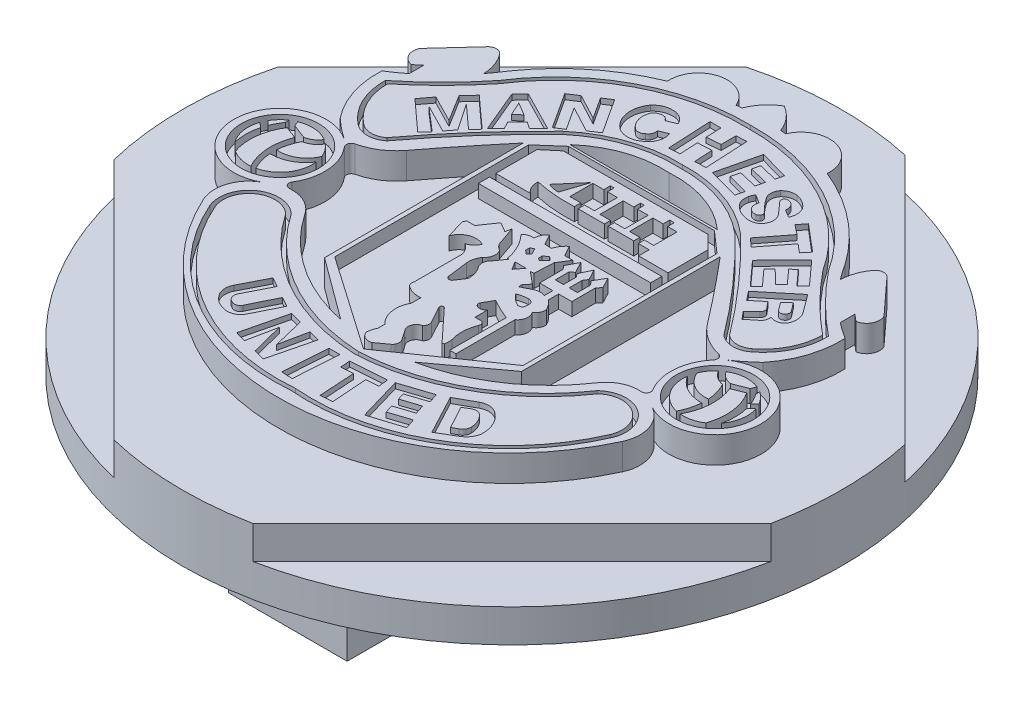
from build123d import *

# Parameters (mm, degrees)
IZIM1_W                     = 300
IZIM1_H                     = 300
Y_KSEKLIK_EKSTR_ZYON1_DEPTH = 35
KES_EKSTR_ZYON1_DEPTH       = 10
KES_EKSTR_ZYON2_DEPTH       = 10
IZIM4_R                     = 14.688787929
KES_EKSTR_ZYON3_DEPTH       = 5
KES_EKSTR_ZYON4_DEPTH       = 5
IZIM6_W                     = 65.340967954
IZIM6_H                     = 4.211050824
KES_EKSTR_ZYON5_DEPTH       = 5
KES_EKSTR_ZYON6_DEPTH       = 2
KES_EKSTR_ZYON7_DEPTH       = 2
KES_EKSTR_ZYON8_DEPTH       = 214.600093633
KES_EKSTR_ZYON8_DEPTH_BACK  = 214.600093633
IZIM9_W                     = 367.063138071
IZIM9_H                     = 317.584407861
IZIM9_R                     = 125
IZIM10_W                    = 593.86793566
IZIM10_H                    = 460.810210373
KES_EKSTR_ZYON9_DEPTH       = 12.5
SCALE1_SCALE_X              = 0.1
SCALE1_SCALE_Y              = 0.1
SCALE1_SCALE_Z              = 0.1
SKETCH1_W                   = 4.5
SKETCH1_H                   = 3
BOSS_EXTRUDE1_DEPTH         = 4


with BuildPart() as part:
    # Çizim1 → Yükseklik-Ekstrüzyon1 (new body)
    with BuildSketch(Plane(origin=(0, 0, 0), x_dir=(1, 0, 0), z_dir=(0, 1, 0))):
        Rectangle(IZIM1_W, IZIM1_H)
    extrude(amount=Y_KSEKLIK_EKSTR_ZYON1_DEPTH)

    # Çizim2 → Kes-Ekstrüzyon1 (cut)
    with BuildSketch(Plane(origin=(0, 35, 0), x_dir=(1, 0, 0), z_dir=(0, 1, 0))):
        with BuildLine():
            Line((0, 150), (0, 104.219558276))
            ThreePointArc((0, 104.219558276), (4.432980086, 100.525251747), (7.359868412, 95.552069879))
            ThreePointArc((7.359868412, 95.552069879), (8.383740752, 95.473303208), (9.406438792, 95.380526726))
            ThreePointArc((9.406438792, 95.380526726), (22.041401655, 101.728253005), (30.290376925, 90.243901807))
            ThreePointArc((30.290376925, 90.243901807), (48.895981366, 79.362277258), (63.63888613, 63.63888613))
            ThreePointArc((63.63888613, 63.63888613), (65.590542943, 60.704656554), (67.673431335, 57.862079648))
            ThreePointArc((67.673431335, 57.862079648), (68.570213066, 62.822644067), (70.963013461, 67.259526204))
            ThreePointArc((70.963013461, 67.259526204), (73.293815615, 68.477288098), (75.723786132, 67.471889672))
            Line((75.723786132, 67.471889672), (87.997898915, 54.072975184))
            ThreePointArc((87.997898915, 54.072975184), (87.89207184, 49.687125695), (84.346755161, 47.103019512))
            Line((84.346755161, 47.103019512), (81.764137181, 49.283896918))
            Line((81.764137181, 49.283896918), (81.764137181, 43.732968519))
            ThreePointArc((81.764137181, 43.732968519), (84.761025634, 41.530263518), (87.860036516, 39.473717561))
            ThreePointArc((87.860036516, 39.473717561), (86.178046704, 27.021815231), (80.159790477, 15.991876275))
            ThreePointArc((80.159790477, 15.991876275), (76.46978014, 12.812148568), (72.561917191, 9.904322618))
            ThreePointArc((72.561917191, 9.904322618), (99.979717827, -3.657702738), (73.992952405, -19.793140332))
            ThreePointArc((73.992952405, -19.793140332), (80.030307363, -27.115490075), (79.482218011, -36.589985244))
            ThreePointArc((79.482218011, -36.589985244), (47.194418585, -73.681319576), (0, -87.5))
            Line((0, -87.5), (0, -150))
            Line((0, -150), (150, -150))
            Line((150, -150), (150, 150))
            Line((150, 150), (0, 150))
        make_face()
    kes_ekstr_zyon1 = extrude(amount=-KES_EKSTR_ZYON1_DEPTH, mode=Mode.SUBTRACT)

    # Çizim3 → Kes-Ekstrüzyon2 (cut)
    with BuildSketch(Plane(origin=(0, 35, 0), x_dir=(1, 0, 0), z_dir=(0, 1, 0))):
        with BuildLine():
            Line((0, 60.484534465), (0, 50.936189454))
            Line((0, 50.936189454), (27.929597264, 50.936189454))
            ThreePointArc((27.929597264, 50.936189454), (14.932854005, 58.541993689), (0, 60.484534465))
        make_face()
        with BuildLine():
            Line((37.348789557, 42.612665797), (37.348789557, -32.761995334))
            Line((37.348789557, -32.761995334), (13.949565394, -50.019716103))
            ThreePointArc((13.949565394, -50.019716103), (37.262544693, -40.226677559), (55.228500691, -22.432773185))
            ThreePointArc((55.228500691, -22.432773185), (60.177397232, -17.950437876), (66.732679932, -16.681116981))
            ThreePointArc((66.732679932, -16.681116981), (68.359310734, -15.854962574), (68.35712211, -14.030557443))
            ThreePointArc((68.35712211, -14.030557443), (65.68599224, -3.061198459), (69.963231631, 7.387102575))
            ThreePointArc((69.963231631, 7.387102575), (70.306076089, 9.173128049), (68.957221273, 10.392972301))
            ThreePointArc((68.957221273, 10.392972301), (62.330623094, 13.16964935), (57.050039772, 18.041730899))
            ThreePointArc((57.050039772, 18.041730899), (47.34946827, 30.447513007), (37.348789557, 42.612665797))
        make_face()
    kes_ekstr_zyon2 = extrude(amount=-KES_EKSTR_ZYON2_DEPTH, mode=Mode.SUBTRACT)

    # Çizim4 → Kes-Ekstrüzyon3 (cut)
    with BuildSketch(Plane(origin=(0, 35, 0), x_dir=(1, 0, 0), z_dir=(0, 1, 0))):
        with Locations((82.5, -4.5)):
            Circle(IZIM4_R)
        with BuildLine():
            Line((82.5, 1.078851419), (87.159313296, 2.881859687))
            ThreePointArc((87.159313296, 2.881859687), (90.232750957, -5.668478078), (89.233474204, -14.699299797))
            ThreePointArc((89.233474204, -14.699299797), (85.486297127, -16.351051458), (81.403841132, -16.672256444))
            ThreePointArc((81.403841132, -16.672256444), (83.96523767, -7.921028015), (82.5, 1.078851419))
        make_face(mode=Mode.SUBTRACT)
        with BuildLine():
            Line((80.967380155, 2.881859687), (86.35286518, 4.965873662))
            Line((86.35286518, 4.965873662), (87.107444607, 6.819754653))
            ThreePointArc((87.107444607, 6.819754653), (81.576062803, 7.686538937), (76.238588844, 5.9957192))
            ThreePointArc((76.238588844, 5.9957192), (78.229966806, 3.872314681), (80.967380155, 2.881859687))
        make_face(mode=Mode.SUBTRACT)
        with BuildLine():
            Line((89.233474204, 4.221967119), (89.233474204, 5.699299797))
            ThreePointArc((89.233474204, 5.699299797), (91.406865656, 3.868580249), (93.098723839, 1.585428841))
            Line((93.098723839, 1.585428841), (91.509736411, 0))
            ThreePointArc((91.509736411, 0), (90.500671693, 2.180569354), (89.233474204, 4.221967119))
        make_face(mode=Mode.SUBTRACT)
        with BuildLine():
            Line((92.201834683, -2.118971392), (94.082148833, -0.598818179))
            ThreePointArc((94.082148833, -0.598818179), (94.570520121, -6.415185421), (92.305735984, -11.79471953))
            ThreePointArc((92.305735984, -11.79471953), (92.857538804, -6.950362161), (92.201834683, -2.118971392))
        make_face(mode=Mode.SUBTRACT)
        with BuildLine():
            ThreePointArc((70.382445993, -2.909315847), (72.461507033, -11.470943275), (79.757489881, -16.409829111))
            ThreePointArc((79.757489881, -16.409829111), (81.213206681, -12.777519679), (81.882268825, -8.921986117))
            ThreePointArc((81.882268825, -8.921986117), (75.339135912, -7.432765055), (70.382445993, -2.909315847))
        make_face(mode=Mode.SUBTRACT)
        with BuildLine():
            ThreePointArc((79.757489881, 1.078851419), (81.213206681, -2.553458012), (81.882268825, -6.408991575))
            ThreePointArc((81.882268825, -6.408991575), (75.445718089, -4.988320525), (71.13710463, 0))
            ThreePointArc((71.13710463, 0), (72.551809573, 2.599218155), (74.549779065, 4.782207619))
            ThreePointArc((74.549779065, 4.782207619), (76.727879252, 2.331826625), (79.757489881, 1.078851419))
        make_face(mode=Mode.SUBTRACT)
    kes_ekstr_zyon3 = extrude(amount=-KES_EKSTR_ZYON3_DEPTH, mode=Mode.SUBTRACT)

    # Çizim5 → Kes-Ekstrüzyon4 (cut)
    with BuildSketch(Plane(origin=(0, 35, 0), x_dir=(1, 0, 0), z_dir=(0, 1, 0))):
        with BuildLine():
            Line((0, 91.537897666), (0, 90.037373971))
            ThreePointArc((0, 90.037373971), (34.910747951, 81.866816476), (61.312588474, 57.608598297))
            ThreePointArc((61.312588474, 57.608598297), (71.365293645, 46.386208855), (82.532386084, 36.272112135))
            ThreePointArc((82.532386084, 36.272112135), (80.156394342, 26.33060929), (73.659387451, 18.43961968))
            ThreePointArc((73.659387451, 18.43961968), (69.304921982, 16.976537244), (64.970096435, 18.496822487))
            ThreePointArc((64.970096435, 18.496822487), (50.048409379, 36.848130455), (33.7148102, 53.95487727))
            ThreePointArc((33.7148102, 53.95487727), (17.964521879, 62.989894684), (0, 65.631688683))
            Line((0, 65.631688683), (0, 64.13036191))
            ThreePointArc((0, 64.13036191), (17.422952638, 61.590013273), (32.704829119, 52.84490601))
            ThreePointArc((32.704829119, 52.84490601), (48.999811849, 35.769263278), (63.881125884, 17.448495569))
            ThreePointArc((63.881125884, 17.448495569), (69.192296648, 15.477862031), (74.572975106, 17.249931654))
            ThreePointArc((74.572975106, 17.249931654), (81.659613563, 25.990705626), (84.026783329, 36.991527484))
            ThreePointArc((84.026783329, 36.991527484), (72.705602185, 47.166452817), (62.530676853, 58.48763396))
            ThreePointArc((62.530676853, 58.48763396), (35.593910706, 83.202369286), (0, 91.537897666))
        make_face()
        with BuildLine():
            Line((0, -57.172237214), (0, -58.673870888))
            ThreePointArc((0, -58.673870888), (33.470224231, -49.143475695), (59.173411607, -25.682220373))
            ThreePointArc((59.173411607, -25.682220373), (71.412315214, -24.833022665), (74.953049001, -36.579303033))
            ThreePointArc((74.953049001, -36.579303033), (44.650227003, -70.940446986), (0, -81.202340739))
            Line((0, -81.202340739), (0, -82.707691122))
            ThreePointArc((0, -82.707691122), (45.482168484, -72.190814928), (76.33669671, -37.158966235))
            ThreePointArc((76.33669671, -37.158966235), (72.200787985, -23.554931007), (58.028078533, -24.699405655))
            ThreePointArc((58.028078533, -24.699405655), (32.84198284, -47.776253871), (0, -57.172237214))
        make_face()
    kes_ekstr_zyon4 = extrude(amount=-KES_EKSTR_ZYON4_DEPTH, mode=Mode.SUBTRACT)

    # Aynalama1: Kes-Ekstrüzyon1, Kes-Ekstrüzyon2, Kes-Ekstrüzyon3, Kes-Ekstrüzyon4 across plane
    add(kes_ekstr_zyon1.mirror(Plane(origin=(0, 0, 0), x_dir=(0, 0, 1), z_dir=(1, 0, 0))), mode=Mode.SUBTRACT)
    add(kes_ekstr_zyon2.mirror(Plane(origin=(0, 0, 0), x_dir=(0, 0, 1), z_dir=(1, 0, 0))), mode=Mode.SUBTRACT)
    add(kes_ekstr_zyon3.mirror(Plane(origin=(0, 0, 0), x_dir=(0, 0, 1), z_dir=(1, 0, 0))), mode=Mode.SUBTRACT)
    add(kes_ekstr_zyon4.mirror(Plane(origin=(0, 0, 0), x_dir=(0, 0, 1), z_dir=(1, 0, 0))), mode=Mode.SUBTRACT)

    # Çizim6 → Kes-Ekstrüzyon5 (cut)
    # profile 1 of 2: a face of its own
    with BuildSketch(Plane(origin=(0, 35, 0), x_dir=(1, 0, 0), z_dir=(0, 1, 0))):
        Polygon((0, -55.345861268), (35.697267904, -30.549471324), (35.697267904, 43.034530322), (27.694930839, 50.073043118), (-27.694930839, 50.073043118), (-35.697267904, 43.034530322), (-35.697267904, -30.549471324), align=None)
        with BuildLine():
            ThreePointArc((-11.906869674, 1.566702336), (-17.201780851, 1.865280834), (-20.93529079, -1.901168027))
            Line((-20.93529079, -1.901168027), (-23.027971181, 5.154154435))
            Line((-23.027971181, 5.154154435), (-22.489853367, 6.290180933))
            Line((-22.489853367, 6.290180933), (-19.437246224, 6.290180933))
            Line((-19.437246224, 6.290180933), (-15.374740037, 12.149686028))
            Line((-15.374740037, 12.149686028), (-11.730178712, 10.012920652))
            Line((-11.730178712, 10.012920652), (-11.254544638, 12.149686028))
            Line((-11.254544638, 12.149686028), (-8.739608735, 4.872878505))
            ThreePointArc((-8.739608735, 4.872878505), (-7.78070785, 3.722161336), (-6.572730693, 2.83647962))
            ThreePointArc((-6.572730693, 2.83647962), (-5.944152943, -0.103025266), (-7.489272369, -2.681475368))
            ThreePointArc((-7.489272369, -2.681475368), (-8.539801594, -5.012163464), (-8.739608735, -7.560848568))
            Line((-8.739608735, -7.560848568), (-7.731825436, -15.169890206))
            ThreePointArc((-7.731825436, -15.169890206), (-6.850368543, -16.300796116), (-5.540421445, -15.717741203))
            Line((-5.540421445, -15.717741203), (-3.318581286, -12.430635216))
            ThreePointArc((-3.318581286, -12.430635216), (-3.666975032, -9.505418471), (-4.96213428, -6.859509604))
            ThreePointArc((-4.96213428, -6.859509604), (-5.713341099, -4.342443779), (-4.509677827, -2.007678956))
            Line((-4.509677827, -2.007678956), (-1.817665055, 1.817665055))
            Line((-1.817665055, 1.817665055), (-2.45075469, 1.817665055))
            ThreePointArc((-2.45075469, 1.817665055), (-4.3537065, 7.360681259), (-7.731825436, 12.149686028))
            ThreePointArc((-7.731825436, 12.149686028), (-6.062401085, 13.24467592), (-4.067810621, 13.331793129))
            ThreePointArc((-4.067810621, 13.331793129), (-3.611472225, 15.589645574), (-2.214160024, 17.420945933))
            Line((-2.214160024, 17.420945933), (0, 13.469173456))
            Line((0, 13.469173456), (2.592810866, 13.331793129))
            ThreePointArc((2.592810866, 13.331793129), (3.668655292, 15.580143772), (5.349122264, 17.420945933))
            Line((5.349122264, 17.420945933), (7.471263253, 13.469173456))
            Line((7.471263253, 13.469173456), (10.601117285, 13.469173456))
            Line((10.601117285, 13.469173456), (7.860312167, 9.196808432))
            Line((7.860312167, 9.196808432), (7.471263253, 1.817665055))
            Line((7.471263253, 1.817665055), (6.086593146, 1.817665055))
            Line((6.086593146, 1.817665055), (10.733699088, -2.007678956))
            Line((10.733699088, -2.007678956), (9.015399913, -4.095103848))
            ThreePointArc((9.015399913, -4.095103848), (8.866578815, -4.803846924), (9.15271193, -5.469123038))
            Line((9.15271193, -5.469123038), (12.568340548, -3.701674631))
            ThreePointArc((12.568340548, -3.701674631), (14.645767491, -3.151586354), (16.760653607, -3.533105072))
            Line((16.760653607, -3.533105072), (16.760653607, -0.278876303))
            Line((16.760653607, -0.278876303), (11.721279291, -0.278876303))
            Line((11.721279291, -0.278876303), (11.721279291, 8.662796732))
            Line((11.721279291, 8.662796732), (10.601117285, 10.012920652))
            Line((10.601117285, 10.012920652), (12.826771642, 14.273760924))
            Line((12.826771642, 14.273760924), (15.031582585, 10.012920652))
            Line((15.031582585, 10.012920652), (13.678220653, 8.890072153))
            Line((13.678220653, 8.890072153), (13.678220653, 3.722161336))
            Line((13.678220653, 3.722161336), (16.762614821, 3.722161336))
            Line((16.762614821, 3.722161336), (16.762614821, 8.661851969))
            Line((16.762614821, 8.661851969), (15.74739773, 9.885486471))
            Line((15.74739773, 9.885486471), (17.860877299, 14.272816161))
            Line((17.860877299, 14.272816161), (19.954360749, 10.227118447))
            Line((19.954360749, 10.227118447), (18.950211911, 8.661851969))
            Line((18.950211911, 8.661851969), (18.950211911, 3.722161336))
            Line((18.950211911, 3.722161336), (22.078611129, 3.722161336))
            Line((22.078611129, 3.722161336), (22.078611129, 8.661851969))
            Line((22.078611129, 8.661851969), (20.779951049, 10.227118447))
            Line((20.779951049, 10.227118447), (23.151898185, 14.272816161))
            Line((23.151898185, 14.272816161), (25.245381635, 10.227118447))
            Line((25.245381635, 10.227118447), (23.956906007, 8.661851969))
            Line((23.956906007, 8.661851969), (23.956906007, -0.278876303))
            Line((23.956906007, -0.278876303), (18.950211911, -0.278876303))
            Line((18.950211911, -0.278876303), (18.950211911, -4.095103848))
            ThreePointArc((18.950211911, -4.095103848), (20.574199594, -5.79542301), (21.797680338, -7.803286581))
            ThreePointArc((21.797680338, -7.803286581), (21.388710462, -9.821714741), (19.954360749, -11.29953391))
            ThreePointArc((19.954360749, -11.29953391), (20.748804959, -14.319714762), (19.133285806, -16.99230374))
            Line((19.133285806, -16.99230374), (19.133285806, -39.39680115))
            Line((19.133285806, -39.39680115), (16.78447584, -39.39680115))
            Line((16.78447584, -39.39680115), (16.78447584, -18.004713661))
            ThreePointArc((16.78447584, -18.004713661), (12.902995138, -16.302688983), (9.15271193, -14.328314066))
            Line((9.15271193, -14.328314066), (7.046465246, -18.004713661))
            ThreePointArc((7.046465246, -18.004713661), (6.935324535, -18.934225509), (7.500637825, -19.680392661))
            ThreePointArc((7.500637825, -19.680392661), (9.263552392, -19.961396521), (10.73358191, -18.948556872))
            Line((10.73358191, -18.948556872), (10.73358191, -23.767312936))
            Line((10.73358191, -23.767312936), (12.902995138, -23.767312936))
            ThreePointArc((12.902995138, -23.767312936), (14.0355512, -24.518153851), (14.071427648, -25.876519853))
            ThreePointArc((14.071427648, -25.876519853), (13.085493265, -30.599388515), (13.678220653, -35.387522728))
            ThreePointArc((13.678220653, -35.387522728), (13.811835683, -36.839167966), (13.678220653, -38.290813204))
            ThreePointArc((13.678220653, -38.290813204), (13.212730159, -38.460384409), (12.747239664, -38.290813204))
            Line((12.747239664, -38.290813204), (1.742324059, -26.42147861))
            ThreePointArc((1.742324059, -26.42147861), (0.800244742, -26.434849011), (0.626041283, -27.36077847))
            Line((0.626041283, -27.36077847), (3.913701048, -33.388041299))
            ThreePointArc((3.913701048, -33.388041299), (4.306791689, -35.024506546), (3.492837434, -36.497604381))
            ThreePointArc((3.492837434, -36.497604381), (1.175770799, -38.65050317), (2.002333093, -41.703463334))
            Line((2.002333093, -41.703463334), (4.350396814, -45.169680354))
            ThreePointArc((4.350396814, -45.169680354), (4.69631917, -46.994407706), (3.701230729, -48.562556673))
            Line((3.701230729, -48.562556673), (-0.532925097, -51.642946573))
            ThreePointArc((-0.532925097, -51.642946573), (-3.201120606, -51.416244529), (-4.96213428, -49.398946354))
            ThreePointArc((-4.96213428, -49.398946354), (-4.736247179, -47.550680958), (-4.067810621, -45.812779199))
            Line((-4.067810621, -45.812779199), (-4.067810621, -43.184786644))
            ThreePointArc((-4.067810621, -43.184786644), (-7.04698599, -37.516118586), (-5.944152943, -31.207945895))
            Line((-5.944152943, -31.207945895), (-5.944152943, -27.63272395))
            ThreePointArc((-5.944152943, -27.63272395), (-8.987982017, -27.430142399), (-11.727702965, -26.088552355))
            ThreePointArc((-11.727702965, -26.088552355), (-12.462599934, -25.016918877), (-12.412411918, -23.718476338))
            Line((-12.412411918, -23.718476338), (-12.412411918, -5.469123038))
            ThreePointArc((-12.412411918, -5.469123038), (-13.509756118, -3.192034431), (-15.374740037, -1.485830515))
            ThreePointArc((-15.374740037, -1.485830515), (-13.225031643, -0.431908753), (-11.906869674, 1.566702336))
        make_face(mode=Mode.SUBTRACT)
        with Locations((0.088920475, 22.929124585)):
            Rectangle(IZIM6_W, IZIM6_H, mode=Mode.SUBTRACT)
        with BuildLine():
            Line((-19.437246224, 27.410090173), (-32.581563502, 27.410090173))
            Line((-32.581563502, 27.410090173), (-32.581563502, 43.034530322))
            Line((-32.581563502, 43.034530322), (-27.117460401, 47.612892427))
            Line((-27.117460401, 47.612892427), (27.694930839, 47.612892427))
            Line((27.694930839, 47.612892427), (32.759404452, 42.548418814))
            Line((32.759404452, 42.548418814), (32.759404452, 27.410090173))
            Line((32.759404452, 27.410090173), (21.606785912, 27.410090173))
            Line((21.606785912, 27.410090173), (21.606785912, 31.395800273))
            Line((21.606785912, 31.395800273), (17.47907507, 31.395800273))
            Line((17.47907507, 31.395800273), (17.47907507, 33.707318345))
            Line((17.47907507, 33.707318345), (21.028906394, 33.707318345))
            Line((21.028906394, 33.707318345), (21.028906394, 42.548418814))
            Line((21.028906394, 42.548418814), (17.47907507, 42.548418814))
            Line((17.47907507, 42.548418814), (17.47907507, 45.08065562))
            Line((17.47907507, 45.08065562), (15.745436516, 45.08065562))
            Line((15.745436516, 45.08065562), (15.745436516, 42.548418814))
            Line((15.745436516, 42.548418814), (11.865388325, 42.548418814))
            Line((11.865388325, 42.548418814), (11.865388325, 33.707318345))
            Line((11.865388325, 33.707318345), (15.745436516, 33.707318345))
            Line((15.745436516, 33.707318345), (15.745436516, 31.395800273))
            Line((15.745436516, 31.395800273), (6.086593146, 31.395800273))
            Line((6.086593146, 31.395800273), (6.086593146, 33.707318345))
            Line((6.086593146, 33.707318345), (10.076635479, 33.707318345))
            Line((10.076635479, 33.707318345), (10.076635479, 42.548418814))
            Line((10.076635479, 42.548418814), (6.086593146, 42.548418814))
            Line((6.086593146, 42.548418814), (6.086593146, 45.08065562))
            Line((6.086593146, 45.08065562), (4.619122655, 45.08065562))
            Line((4.619122655, 45.08065562), (4.619122655, 42.548418814))
            Line((4.619122655, 42.548418814), (0.626041283, 42.548418814))
            Line((0.626041283, 42.548418814), (0.626041283, 33.707318345))
            Line((0.626041283, 33.707318345), (4.619122655, 33.707318345))
            Line((4.619122655, 33.707318345), (4.619122655, 31.395800273))
            Line((4.619122655, 31.395800273), (-5.340632032, 31.395800273))
            Line((-5.340632032, 31.395800273), (-5.340632032, 33.846465558))
            Line((-5.340632032, 33.846465558), (-1.577038095, 33.846465558))
            Line((-1.577038095, 33.846465558), (-1.577038095, 42.548418814))
            Line((-1.577038095, 42.548418814), (-5.340632032, 42.548418814))
            Line((-5.340632032, 42.548418814), (-5.340632032, 45.08065562))
            Line((-5.340632032, 45.08065562), (-6.76345413, 45.08065562))
            Line((-6.76345413, 45.08065562), (-6.76345413, 42.548418814))
            Line((-6.76345413, 42.548418814), (-10.894227963, 42.548418814))
            Line((-10.894227963, 42.548418814), (-10.894227963, 33.846465558))
            Line((-10.894227963, 33.846465558), (-6.76345413, 33.846465558))
            Line((-6.76345413, 33.846465558), (-6.76345413, 31.395800273))
            ThreePointArc((-6.76345413, 31.395800273), (-14.289337946, 31.500217152), (-21.732010715, 32.621132916))
            ThreePointArc((-21.732010715, 32.621132916), (-21.270743043, 29.713470219), (-19.437246224, 27.410090173))
        make_face(mode=Mode.SUBTRACT)
    # profile 2 of 2: a face of its own
    with BuildSketch(Plane(origin=(0, 35, 0), x_dir=(1, 0, 0), z_dir=(0, 1, 0))):
        with BuildLine():
            Line((-11.421684921, 42.548418814), (-18.800246452, 33.985612772))
            ThreePointArc((-18.800246452, 33.985612772), (-16.737365632, 33.32270417), (-14.577575697, 33.148829141))
            Line((-14.577575697, 33.148829141), (-11.421684921, 42.548418814))
        make_face()
    extrude(amount=-KES_EKSTR_ZYON5_DEPTH, mode=Mode.SUBTRACT)

    # Çizim7 → Kes-Ekstrüzyon6 (cut)
    with BuildSketch(Plane(origin=(0, 35, 0), x_dir=(1, 0, 0), z_dir=(0, 1, 0))):
        Polygon((0.703612598, 7.845426438), (-0.386454355, 10.025560346), (-1.6945347, 9.371520173), (-1.6945347, 7.845426438), (-0.386454355, 6.755359484), align=None)
        Polygon((3.340871358, 9.076147192), (3.340871358, 7.634445737), (4.360611411, 7.001503635), (6.294601168, 9.076147192), (4.990363937, 10.29196156), align=None)
        with BuildLine():
            Line((16.741990542, -8.813380095), (16.741990542, -10.748073038))
            ThreePointArc((16.741990542, -10.748073038), (15.847777893, -11.687806963), (14.552970419, -11.609132211))
            ThreePointArc((14.552970419, -11.609132211), (12.502489835, -10.19769508), (10.797523251, -8.383938111))
            ThreePointArc((10.797523251, -8.383938111), (12.795064826, -7.773041871), (14.870496564, -7.536505057))
            ThreePointArc((14.870496564, -7.536505057), (16.010948354, -7.874910239), (16.741990542, -8.813380095))
        make_face()
        Polygon((0.137409128, 1.989800269), (4.360611411, 1.989800269), (2.000582151, -1.040661875), align=None)
    extrude(amount=-KES_EKSTR_ZYON6_DEPTH, mode=Mode.SUBTRACT)

    # Çizim8 → Kes-Ekstrüzyon7 (cut)
    # profile 1 of 16: a face of its own
    with BuildSketch(Plane(origin=(0, 35, 0), x_dir=(1, 0, 0), z_dir=(0, 1, 0))):
        with BuildLine():
            Line((-36.878989151, -51.18206824), (-40.477513516, -49.157632127))
            Line((-40.477513516, -49.157632127), (-45.527339298, -58.994955079))
            ThreePointArc((-45.527339298, -58.994955079), (-46.095906294, -62.5960552), (-44.416497313, -65.831913044))
            ThreePointArc((-44.416497313, -65.831913044), (-42.570633634, -67.464069897), (-40.302403177, -68.426503951))
            ThreePointArc((-40.302403177, -68.426503951), (-36.432914344, -68.505901945), (-33.556940072, -65.915917418))
            Line((-33.556940072, -65.915917418), (-28.563999711, -55.859864803))
            Line((-28.563999711, -55.859864803), (-32.272676693, -53.773459696))
            Line((-32.272676693, -53.773459696), (-37.186553146, -63.8295643))
            ThreePointArc((-37.186553146, -63.8295643), (-38.503676914, -64.980515456), (-40.2474978, -64.84416186))
            Line((-40.2474978, -64.84416186), (-40.780484105, -64.569295895))
            ThreePointArc((-40.780484105, -64.569295895), (-42.058441283, -63.063383005), (-41.904082358, -61.094342247))
            Line((-41.904082358, -61.094342247), (-36.878989151, -51.18206824))
        make_face()
    # profile 2 of 16: a face of its own
    with BuildSketch(Plane(origin=(0, 35, 0), x_dir=(1, 0, 0), z_dir=(0, 1, 0))):
        Polygon((-25.298621527, -57.344666789), (-29.38094151, -74.040308771), (-25.298621527, -75.247949763), (-23.050652212, -64.19741257), (-19.900173735, -76.59282306), (-15.740870053, -77.628998026), (-11.592845859, -60.978439117), (-15.740870053, -59.867489225), (-17.919043096, -70.324350837), (-20.810018035, -58.442193662), align=None)
    # profile 3 of 16: a face of its own
    with BuildSketch(Plane(origin=(0, 35, 0), x_dir=(1, 0, 0), z_dir=(0, 1, 0))):
        Polygon((-6.802331021, -61.660120396), (-7.920467125, -78.358714999), (-3.785927901, -78.635563302), (-2.649254064, -61.660120396), align=None)
    # profile 4 of 16: a face of its own
    with BuildSketch(Plane(origin=(0, 35, 0), x_dir=(1, 0, 0), z_dir=(0, 1, 0))):
        Polygon((14.765601356, -60.978439117), (1.363720079, -61.928828714), (1.624361504, -65.604253445), (6.186850811, -65.324527288), (7.013889149, -78.813982856), (11.481848122, -78.49713915), (10.525896515, -65.01682542), (15.131171475, -64.690244), align=None)
    # profile 5 of 16: a face of its own
    with BuildSketch(Plane(origin=(0, 35, 0), x_dir=(1, 0, 0), z_dir=(0, 1, 0))):
        Polygon((28.836283007, -56.563771447), (17.128812053, -60.422964171), (21.914597806, -76.844358163), (34.049190107, -73.000292507), (32.797057298, -69.201749768), (25.04535568, -71.756982285), (24.047690681, -68.730407859), (31.140088694, -66.392504915), (29.990826379, -62.906036078), (23.131360947, -65.167156279), (22.287017378, -62.605706639), (29.990826379, -60.066261206), align=None)
    # profile 6 of 16: a face of its own
    with BuildSketch(Plane(origin=(0, 35, 0), x_dir=(1, 0, 0), z_dir=(0, 1, 0))):
        with BuildLine():
            Line((39.412620274, -50.883864393), (32.389175883, -54.783537382))
            Line((32.389175883, -54.783537382), (40.345116102, -69.745454809))
            Line((40.345116102, -69.745454809), (46.797579903, -65.915917418))
            ThreePointArc((46.797579903, -65.915917418), (49.101753177, -63.884707771), (50.300943301, -61.056816302))
            ThreePointArc((50.300943301, -61.056816302), (49.138873875, -55.315254974), (45.245653323, -50.938182256))
            ThreePointArc((45.245653323, -50.938182256), (42.336305948, -50.141149833), (39.412620274, -50.883864393))
        make_face()
        with BuildLine():
            Line((42.302943445, -64.609304006), (37.66812264, -56.0504154))
            Line((37.66812264, -56.0504154), (39.996627377, -54.636490621))
            ThreePointArc((39.996627377, -54.636490621), (41.561738376, -54.175129312), (43.149923324, -54.549422335))
            ThreePointArc((43.149923324, -54.549422335), (45.251150993, -57.167206409), (46.121810065, -60.409104612))
            ThreePointArc((46.121810065, -60.409104612), (45.711290845, -62.185661489), (44.413463061, -63.466412601))
            Line((44.413463061, -63.466412601), (42.302943445, -64.609304006))
        make_face(mode=Mode.SUBTRACT)
    # profile 7 of 16: a face of its own
    with BuildSketch(Plane(origin=(0, 35, 0), x_dir=(1, 0, 0), z_dir=(0, 1, 0))):
        Polygon((-72.463336926, 36.626177245), (-60.923820012, 26.156549317), (-58.31377494, 29.033314323), (-67.351393699, 36.80079961), (-56.525887195, 31.26595418), (-54.071056677, 34.484509748), (-60.923820012, 44.606532158), (-52.127954378, 36.626177245), (-49.672827835, 39.332192632), (-61.400497764, 49.972528925), (-65.05053467, 45.949495546), (-58.860462683, 35.938391469), (-69.024408044, 41.134995112), align=None)
    # profile 8 of 16: a face of its own
    with BuildSketch(Plane(origin=(0, 35, 0), x_dir=(1, 0, 0), z_dir=(0, 1, 0))):
        Polygon((-55.5366628, 56.4355879), (-48.917150628, 40.616354702), (-45.678502604, 43.734697084), (-47.177490359, 46.532282918), (-43.449853403, 50.259919873), (-40.94991106, 48.525971301), (-37.482013915, 51.993868446), (-52.568380244, 59.707198599), align=None)
        Polygon((-46.464212488, 51.993868446), (-48.917150628, 49.702322325), (-51.295203529, 54.873524003), align=None, mode=Mode.SUBTRACT)
    # profile 9 of 16: a face of its own
    with BuildSketch(Plane(origin=(0, 35, 0), x_dir=(1, 0, 0), z_dir=(0, 1, 0))):
        Polygon((-45.678502604, 66.680162097), (-36.878989151, 53.156302423), (-33.674189767, 55.241555892), (-39.224440982, 63.771665992), (-29.38094151, 58.550270479), (-25.665535781, 60.967758052), (-34.238649236, 74.143666466), (-37.482013915, 72.033319877), (-32.272676693, 64.027156132), (-41.904082358, 69.136048399), align=None)
    # profile 10 of 16: a face of its own
    with BuildSketch(Plane(origin=(0, 35, 0), x_dir=(1, 0, 0), z_dir=(0, 1, 0))):
        with BuildLine():
            Line((-17.919358577, 76.761037571), (-14.323272427, 78.278066867))
            ThreePointArc((-14.323272427, 78.278066867), (-15.991974076, 80.515789655), (-18.534020172, 81.669032956))
            ThreePointArc((-18.534020172, 81.669032956), (-22.423335538, 81.354059493), (-25.665535781, 79.182857087))
            ThreePointArc((-25.665535781, 79.182857087), (-27.513534644, 72.78090754), (-24.833802783, 66.680162097))
            ThreePointArc((-24.833802783, 66.680162097), (-20.241143891, 64.37089612), (-15.298190065, 65.782431638))
            ThreePointArc((-15.298190065, 65.782431638), (-12.582479976, 69.116510604), (-12.645831584, 73.416179243))
            Line((-12.645831584, 73.416179243), (-15.923870727, 72.033319877))
            ThreePointArc((-15.923870727, 72.033319877), (-16.012059363, 70.217642859), (-17.212536558, 68.852609975))
            ThreePointArc((-17.212536558, 68.852609975), (-19.163002796, 68.032195279), (-21.113469033, 68.852609975))
            ThreePointArc((-21.113469033, 68.852609975), (-23.262740103, 72.342668969), (-23.050967692, 76.435959864))
            ThreePointArc((-23.050967692, 76.435959864), (-21.381771954, 77.906975536), (-19.163318276, 78.075986774))
            ThreePointArc((-19.163318276, 78.075986774), (-18.406748074, 77.545836463), (-17.919358577, 76.761037571))
        make_face()
    # profile 11 of 16: a face of its own
    with BuildSketch(Plane(origin=(0, 35, 0), x_dir=(1, 0, 0), z_dir=(0, 1, 0))):
        Polygon((-8.954786903, 85.044452355), (-8.131583455, 68.542339753), (-4.038526113, 68.746520818), (-4.385420097, 75.700431905), (0.877812476, 75.962986846), (1.22470646, 69.009075759), (5.386412089, 69.216681325), (4.573428222, 85.513930016), (0.651465735, 85.318283972), (0.651465735, 79.655578924), (-4.545417384, 79.182857087), (-4.837821487, 85.044452355), align=None)
    # profile 12 of 16: a face of its own
    with BuildSketch(Plane(origin=(0, 35, 0), x_dir=(1, 0, 0), z_dir=(0, 1, 0))):
        Polygon((22.969551574, 81.352363637), (11.991645293, 84.432081558), (8.232756131, 68.746520818), (19.882553805, 65.633631015), (20.714579054, 68.747434081), (12.829962131, 70.854246946), (13.683922969, 74.050142599), (20.714552926, 72.385381392), (21.499513524, 75.700431905), (14.468408209, 77.36530567), (15.131171475, 80.164291648), (22.287017378, 78.469880944), align=None)
    # profile 13 of 16: a face of its own
    with BuildSketch(Plane(origin=(0, 35, 0), x_dir=(1, 0, 0), z_dir=(0, 1, 0))):
        with BuildLine():
            Line((27.054386547, 67.666263256), (23.81122859, 69.632031684))
            ThreePointArc((23.81122859, 69.632031684), (23.281665646, 68.695699677), (22.969551574, 67.666263256))
            ThreePointArc((22.969551574, 67.666263256), (22.925823976, 65.496558381), (23.81122859, 63.515248204))
            ThreePointArc((23.81122859, 63.515248204), (26.62433511, 61.148176179), (30.128209585, 60.034864933))
            ThreePointArc((30.128209585, 60.034864933), (31.938465157, 60.112952579), (33.6388239, 60.738974192))
            ThreePointArc((33.6388239, 60.738974192), (34.929809824, 62.194998299), (35.585438171, 64.027156132))
            ThreePointArc((35.585438171, 64.027156132), (35.356683904, 65.969759852), (34.38307519, 67.666263256))
            Line((34.38307519, 67.666263256), (30.392570125, 72.189625229))
            ThreePointArc((30.392570125, 72.189625229), (30.314570976, 73.301391393), (31.140088694, 74.050142599))
            ThreePointArc((31.140088694, 74.050142599), (33.238006976, 73.523274967), (34.38307519, 71.68815388))
            ThreePointArc((34.38307519, 71.68815388), (34.472469384, 71.008396153), (34.38307519, 70.328638427))
            Line((34.38307519, 70.328638427), (37.360354952, 68.542339753))
            ThreePointArc((37.360354952, 68.542339753), (37.930444876, 71.324366423), (37.13368949, 74.050142599))
            ThreePointArc((37.13368949, 74.050142599), (34.719438403, 76.213304227), (31.689459985, 77.36530567))
            ThreePointArc((31.689459985, 77.36530567), (29.172112936, 77.089148533), (27.054386547, 75.700431905))
            ThreePointArc((27.054386547, 75.700431905), (26.139087021, 73.42189434), (26.591340451, 71.008396153))
            ThreePointArc((26.591340451, 71.008396153), (28.542357945, 68.322448914), (30.783183498, 65.873064773))
            ThreePointArc((30.783183498, 65.873064773), (31.494384134, 64.375855368), (30.299068208, 63.227525196))
            ThreePointArc((30.299068208, 63.227525196), (27.821025778, 63.973144199), (26.784345679, 66.344206483))
            ThreePointArc((26.784345679, 66.344206483), (26.892251119, 67.010773328), (27.054386547, 67.666263256))
        make_face()
    # profile 14 of 16: a face of its own
    with BuildSketch(Plane(origin=(0, 35, 0), x_dir=(1, 0, 0), z_dir=(0, 1, 0))):
        Polygon((44.657323305, 64.43964997), (36.898147309, 54.494591809), (40.085297446, 51.624226263), (47.880881724, 61.615949492), (51.090454206, 58.902746923), (53.384051943, 61.615949492), (43.263922578, 70.170970804), (41.01156367, 67.284086894), align=None)
    # profile 15 of 16: a face of its own
    with BuildSketch(Plane(origin=(0, 35, 0), x_dir=(1, 0, 0), z_dir=(0, 1, 0))):
        Polygon((44.657323305, 47.556928825), (52.914126419, 38.427050794), (55.212153066, 40.736234801), (49.735853323, 46.791598846), (51.854317767, 48.955775821), (56.974252683, 43.943986028), (59.197335735, 46.215039086), (54.424161869, 51.492928678), (56.34473196, 53.229837874), (61.475150235, 47.556928825), (63.839727154, 49.972528925), (55.76349092, 58.902746923), align=None)
    # profile 16 of 16: a face of its own
    with BuildSketch(Plane(origin=(0, 35, 0), x_dir=(1, 0, 0), z_dir=(0, 1, 0))):
        with BuildLine():
            Line((66.370946056, 46.791598846), (54.063139742, 36.626177245))
            Line((54.063139742, 36.626177245), (56.711844696, 33.265271105))
            Line((56.711844696, 33.265271105), (61.124795076, 36.905448))
            Line((61.124795076, 36.905448), (63.121790902, 34.484509748))
            ThreePointArc((63.121790902, 34.484509748), (63.493305347, 33.265271105), (62.891040872, 32.141953094))
            Line((62.891040872, 32.141953094), (59.678984223, 29.033314323))
            Line((59.678984223, 29.033314323), (62.042926731, 26.159018424))
            Line((62.042926731, 26.159018424), (65.250148378, 28.796773146))
            ThreePointArc((65.250148378, 28.796773146), (66.64816758, 30.340398642), (66.885007928, 32.4094912))
            ThreePointArc((66.885007928, 32.4094912), (69.568665414, 32.005232556), (71.857098007, 33.464176974))
            ThreePointArc((71.857098007, 33.464176974), (72.574372394, 36.815539325), (71.383256003, 40.029159385))
            Line((71.383256003, 40.029159385), (66.370946056, 46.791598846))
        make_face()
        with BuildLine():
            Line((66.135985145, 35.938391469), (63.839727154, 38.988196783))
            Line((63.839727154, 38.988196783), (66.34055249, 41.324479342))
            Line((66.34055249, 41.324479342), (68.580745971, 38.427050794))
            ThreePointArc((68.580745971, 38.427050794), (68.555951925, 36.00625949), (66.135985145, 35.938391469))
        make_face(mode=Mode.SUBTRACT)
    extrude(amount=-KES_EKSTR_ZYON7_DEPTH, mode=Mode.SUBTRACT)

    # Çizim9 → Kes-Ekstrüzyon8 (cut, two sides: drawn at the far end of the back side and taken through both)
    with BuildSketch(Plane(origin=(0, 25, 0), x_dir=(1, 0, 0), z_dir=(0, 1, 0)).offset(-KES_EKSTR_ZYON8_DEPTH_BACK)):
        with Locations((1.43833518, -0.287667036)):
            Rectangle(IZIM9_W, IZIM9_H)
        with Locations((2.000582151, -1.040661875)):
            Circle(IZIM9_R, mode=Mode.SUBTRACT)
    extrude(amount=KES_EKSTR_ZYON8_DEPTH + KES_EKSTR_ZYON8_DEPTH_BACK, mode=Mode.SUBTRACT)

    # Çizim10 → Kes-Ekstrüzyon9 (cut)
    with BuildSketch(Plane(origin=(0, 25, 0), x_dir=(1, 0, 0), z_dir=(0, 1, 0))):
        with Locations((17.568243254, -22.720972131)):
            Rectangle(IZIM10_W, IZIM10_H)
        Polygon((-150, 0), (0, 150), (150, 0), (0, -150), align=None, mode=Mode.SUBTRACT)
    extrude(amount=-KES_EKSTR_ZYON9_DEPTH, mode=Mode.SUBTRACT)


with BuildPart() as part_1:
    # Scale1: scaled about (1.189334741, 14.596409065, -0.427437745)
    add(part.part.scale((SCALE1_SCALE_X, SCALE1_SCALE_Y, SCALE1_SCALE_Z), about=(1.189334741, 14.596409065, -0.427437745)))

    # Sketch1 → Boss-Extrude1 (add)
    with BuildSketch(Plane(origin=(0, 13.136768159, 0), x_dir=(-1, 0, 0), z_dir=(0, -1, 0))):
        with Locations((-1.270459482, 7.280627783)):
            Rectangle(SKETCH1_W, SKETCH1_H)
        with Locations((-1.270459482, -6.719372217)):
            Rectangle(SKETCH1_W, SKETCH1_H)
    extrude(amount=BOSS_EXTRUDE1_DEPTH)


solid = part_1.part
